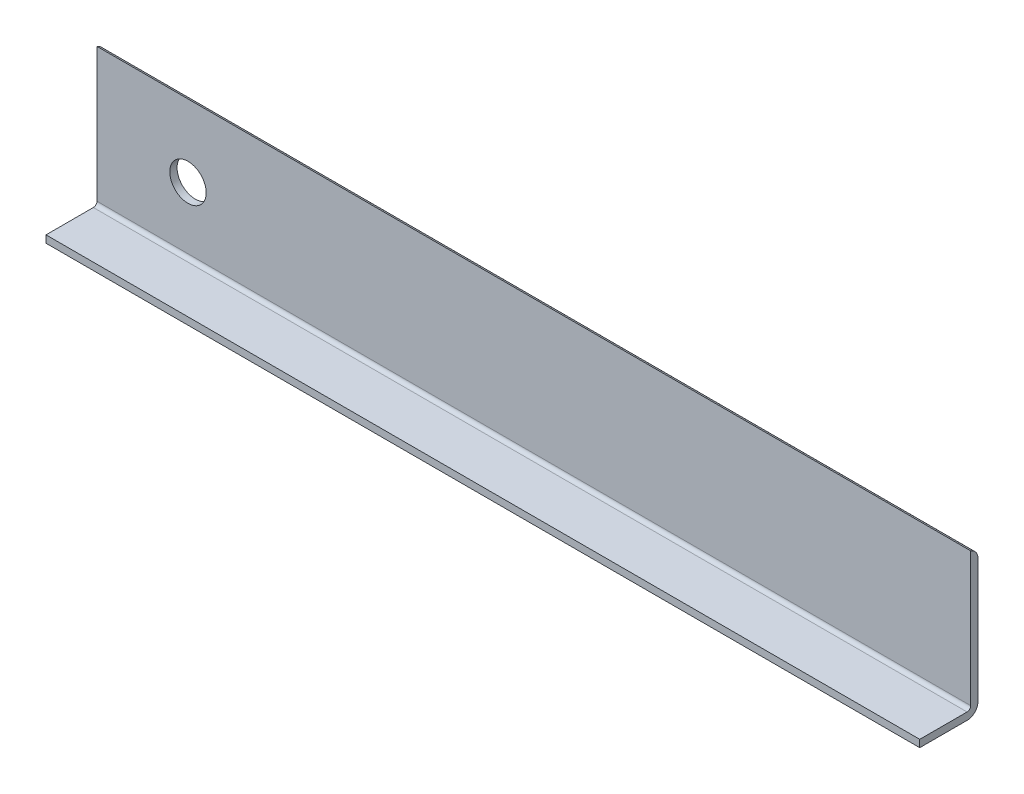
from build123d import *

# Parameters (mm, degrees)
EXTRUDE_1_DEPTH     = 240
SKETCH_2_W          = 240
SKETCH_2_H          = 4
CUT_EXTRUDE_1_DEPTH = 25
SKETCH_3_W          = 240
SKETCH_3_H          = 18
CUT_EXTRUDE_2_DEPTH = 25
SKETCH_4_R          = 5
CUT_EXTRUDE_3_DEPTH = 10


with BuildPart() as part:
    # Эскиз1 → Вытянуть-Тонкостенный1 (new body)
    with BuildSketch(Plane(origin=(0, 0, 0), x_dir=(0, 0, -1), z_dir=(1, 0, 0))):
        with BuildLine():
            Line((-2, 35), (-2, 1))
            ThreePointArc((-2, 1), (-1.121320344, -1.121320344), (1, -2))
            Line((1, -2), (15, -2))
            ThreePointArc((15, -2), (17.121320344, -1.121320344), (18, 1))
            Line((18, 1), (18, 35))
            ThreePointArc((18, 35), (17.121320344, 37.121320344), (15, 38))
            Line((15, 38), (1, 38))
            ThreePointArc((1, 38), (-1.121320344, 37.121320344), (-2, 35))
        make_face()
        with BuildLine():
            Line((0, 35), (0, 1))
            ThreePointArc((0, 1), (0.292893219, 0.292893219), (1, 0))
            Line((1, 0), (15, 0))
            ThreePointArc((15, 0), (15.707106781, 0.292893219), (16, 1))
            Line((16, 1), (16, 35))
            ThreePointArc((16, 35), (15.707106781, 35.707106781), (15, 36))
            Line((15, 36), (1, 36))
            ThreePointArc((1, 36), (0.292893219, 35.707106781), (0, 35))
        make_face(mode=Mode.SUBTRACT)
    extrude(amount=EXTRUDE_1_DEPTH)

    # Эскиз2 → Вырез-Вытянуть1 (cut)
    with BuildSketch(Plane.XZ.offset(2)):
        with Locations((120, 0)):
            Rectangle(SKETCH_2_W, SKETCH_2_H)
    extrude(amount=-CUT_EXTRUDE_1_DEPTH, mode=Mode.SUBTRACT)

    # Эскиз3 → Вырез-Вытянуть2 (cut)
    with BuildSketch(Plane(origin=(0, 38, 0), x_dir=(1, 0, 0), z_dir=(0, 1, 0))):
        with Locations((120, 7)):
            Rectangle(SKETCH_3_W, SKETCH_3_H)
    extrude(amount=-CUT_EXTRUDE_2_DEPTH, mode=Mode.SUBTRACT)

    # Эскиз4 → Вырез-Вытянуть3 (cut)
    with BuildSketch(Plane(origin=(0, 0, -18), x_dir=(-1, 0, 0), z_dir=(0, 0, -1))):
        with Locations((-25, 18)):
            Circle(SKETCH_4_R)
    extrude(amount=-CUT_EXTRUDE_3_DEPTH, mode=Mode.SUBTRACT)


solid = part.part
